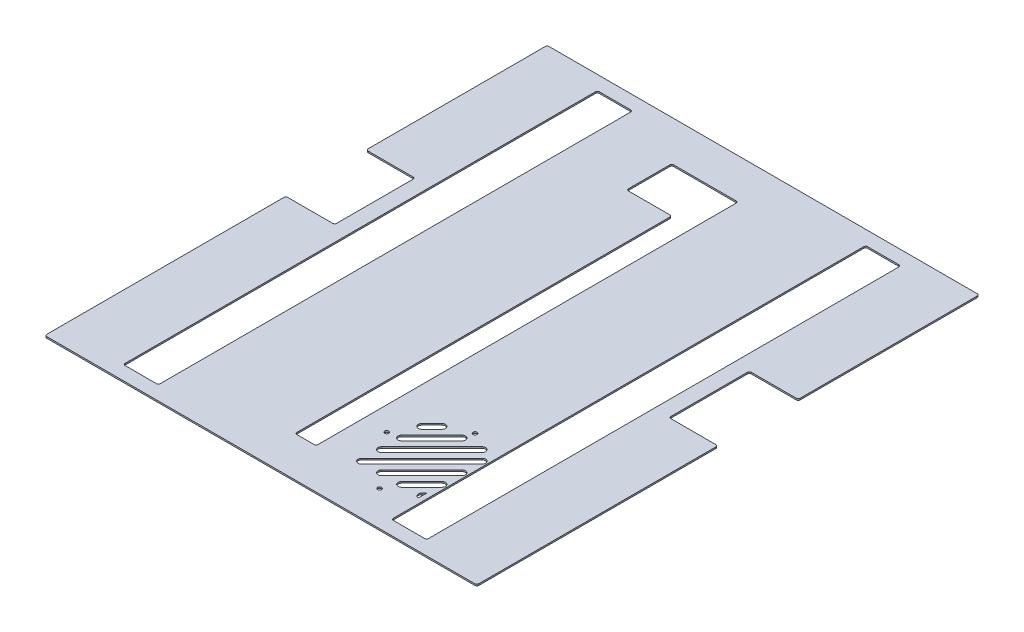
from build123d import *

# Parameters (mm, degrees)
SKETCH1_W           = 430
SKETCH1_H           = 500
BOSS_EXTRUDE1_DEPTH = 1.5
SKETCH2_W           = 48.6
SKETCH2_H           = 80
CUT_EXTRUDE1_DEPTH  = 10
SKETCH3_W           = 35
SKETCH3_H           = 472
CUT_EXTRUDE2_DEPTH  = 10
CUT_EXTRUDE3_DEPTH  = 10
FILLET2_R           = 2
FILLET3_R           = 2
SKETCH6_R           = 2
CUT_EXTRUDE4_DEPTH  = 10


with BuildPart() as part:
    # Sketch1 → Boss-Extrude1 (new body)
    with BuildSketch(Plane(origin=(0, 0, 0), x_dir=(1, 0, 0), z_dir=(0, 1, 0))):
        with Locations((6126.084066999, -8702.312377786)):
            Rectangle(SKETCH1_W, SKETCH1_H)
    extrude(amount=BOSS_EXTRUDE1_DEPTH)

    # Sketch2 → Cut-Extrude1 (cut)
    with BuildSketch(Plane(origin=(0, 1.5, 0), x_dir=(1, 0, 0), z_dir=(0, 1, 0))):
        with Locations((5935.384066999, -8672.447976714)):
            Rectangle(SKETCH2_W, SKETCH2_H)
        with Locations((6316.784066999, -8672.447976714)):
            Rectangle(SKETCH2_W, SKETCH2_H)
    extrude(amount=-CUT_EXTRUDE1_DEPTH, mode=Mode.SUBTRACT)

    # Sketch3 → Cut-Extrude2 (cut)
    with BuildSketch(Plane(origin=(0, 1.5, 0), x_dir=(1, 0, 0), z_dir=(0, 1, 0))):
        Polygon((5975.084066999, -8541.651929061), (5975.084066999, -8938.312377786), (6010.084066999, -8938.312377786), (6010.084066999, -8466.312377786), (5975.084066999, -8466.312377786), align=None)
        with Locations((6259.584066999, -8702.312377786)):
            Rectangle(SKETCH3_W, SKETCH3_H)
        Polygon((6111.084066999, -8492.312377786), (6141.084066999, -8492.312377786), (6141.084066999, -8912.312377786), (6120.084066999, -8912.312377786), (6120.084066999, -8537.312377786), (6075.084066999, -8537.312377786), (6075.084066999, -8492.312377786), align=None)
    extrude(amount=-CUT_EXTRUDE2_DEPTH, mode=Mode.SUBTRACT)

    # Sketch4 → Cut-Extrude3 (cut)
    with BuildSketch(Plane(origin=(0, 1.5, 0), x_dir=(1, 0, 0), z_dir=(0, 1, 0))):
        with BuildLine():
            Line((6234.584067167, -8840.596520357), (6177.084066999, -8898.096518708))
            Line((6177.084066999, -8898.096518708), (6174.584066999, -8900.596520952))
            ThreePointArc((6174.584066999, -8900.596520952), (6174.584069169, -8905.596518633), (6179.584066849, -8905.596518637))
            Line((6179.584066849, -8905.596518637), (6237.084067092, -8848.096520211))
            Line((6237.084067092, -8848.096520211), (6239.584067017, -8845.596520365))
            ThreePointArc((6239.584067017, -8845.596520365), (6239.584067096, -8840.596520436), (6234.584067167, -8840.596520357))
        make_face()
        with BuildLine():
            ThreePointArc((6174.584067387, -8880.596519017), (6174.584067598, -8885.596518612), (6179.584067193, -8885.596518981))
            Line((6179.584067193, -8885.596518981), (6229.584067988, -8835.596519766))
            ThreePointArc((6229.584067988, -8835.596519766), (6229.584069287, -8830.596518949), (6224.584068469, -8830.596519802))
            Line((6224.584068469, -8830.596519802), (6222.084069197, -8833.096518708))
            Line((6222.084069197, -8833.096518708), (6174.584067387, -8880.596519017))
        make_face()
        with BuildLine():
            ThreePointArc((6174.584067774, -8860.596519406), (6174.584068373, -8865.596518613), (6179.58406758, -8865.59651937))
            Line((6179.58406758, -8865.59651937), (6209.58406806, -8835.596519838))
            ThreePointArc((6209.58406806, -8835.596519838), (6209.584069287, -8830.596518805), (6204.584068254, -8830.596519874))
            Line((6204.584068254, -8830.596519874), (6174.584067774, -8860.596519406))
        make_face()
        with BuildLine():
            Line((6219.584066911, -8905.596518637), (6239.584067017, -8885.596519163))
            ThreePointArc((6239.584067017, -8885.596519163), (6239.584067096, -8880.596519234), (6234.584067167, -8880.596519155))
            Line((6234.584067167, -8880.596519155), (6214.584067061, -8900.596518629))
            ThreePointArc((6214.584067061, -8900.596518629), (6214.584066907, -8905.596518633), (6219.584066911, -8905.596518637))
        make_face()
        with BuildLine():
            ThreePointArc((6174.584068161, -8840.596519794), (6174.584069147, -8845.596518614), (6179.584067967, -8845.596519758))
            Line((6179.584067967, -8845.596519758), (6189.584068132, -8835.59651991))
            ThreePointArc((6189.584068132, -8835.59651991), (6189.584069431, -8830.596518805), (6184.584068325, -8830.596519946))
            Line((6184.584068325, -8830.596519946), (6174.584068161, -8840.596519794))
        make_face()
        with BuildLine():
            Line((6234.584067693, -8860.59651923), (6194.58406703, -8900.596518629))
            ThreePointArc((6194.58406703, -8900.596518629), (6194.584066876, -8905.596518633), (6199.58406688, -8905.596518637))
            Line((6199.58406688, -8905.596518637), (6237.084067092, -8868.096519609))
            Line((6237.084067092, -8868.096519609), (6239.584067543, -8865.596517133))
            ThreePointArc((6239.584067543, -8865.596517133), (6239.584066044, -8860.596518783), (6234.584067693, -8860.59651923))
        make_face()
        with BuildLine():
            Line((6237.084067092, -8898.096518708), (6234.584067092, -8900.596518629))
            ThreePointArc((6234.584067092, -8900.596518629), (6233.817659407, -8904.449508447), (6237.084067092, -8906.632051027))
            Line((6237.084067092, -8906.632051027), (6237.084067092, -8898.096518708))
        make_face()
    extrude(amount=-CUT_EXTRUDE3_DEPTH, mode=Mode.SUBTRACT)

    # Fillet2
    fillet2_edges = [part.edges().sort_by_distance(p)[0] for p in [
        (6292.484066999, 0.75, 8632.447976714),
        (6341.084066999, 0.75, 8632.447976714),
        (6341.084066999, 0.75, 8712.447976714),
        (6292.484066999, 0.75, 8712.447976714),
        (5959.684066999, 0.75, 8632.447976714),
        (5959.684066999, 0.75, 8712.447976714),
        (5911.084066999, 0.75, 8712.447976714),
        (5911.084066999, 0.75, 8632.447976714),
        (5911.084066999, 0.75, 8452.312377786),
        (6341.084066999, 0.75, 8452.312377786),
        (6341.084066999, 0.75, 8952.312377786),
        (5911.084066999, 0.75, 8952.312377786),
    ]]
    fillet(fillet2_edges, radius=FILLET2_R)

    # Fillet3
    fillet3_edges = [part.edges().sort_by_distance(p)[0] for p in [
        (6010.084066999, 0.75, 8938.312377786),
        (5975.084066999, 0.75, 8938.312377786),
        (6010.084066999, 0.75, 8466.312377786),
        (5975.084066999, 0.75, 8466.312377786),
        (6277.084066999, 0.75, 8938.312377786),
        (6242.084066999, 0.75, 8938.312377786),
        (6277.084066999, 0.75, 8466.312377786),
        (6242.084066999, 0.75, 8466.312377786),
        (6141.084066999, 0.75, 8912.312377786),
        (6120.084066999, 0.75, 8912.312377786),
        (6141.084066999, 0.75, 8492.312377786),
        (6120.084066999, 0.75, 8537.312377786),
        (6075.084066999, 0.75, 8492.312377786),
        (6075.084066999, 0.75, 8537.312377786),
    ]]
    fillet(fillet3_edges, radius=FILLET3_R)

    # Sketch6 → Cut-Extrude4 (cut)
    with BuildSketch(Plane(origin=(0, 1.5, 0), x_dir=(1, 0, 0), z_dir=(0, 1, 0))):
        with Locations((6209.584066999, -8822.590833699)):
            Circle(SKETCH6_R)
        with Locations((6209.584066999, -8917.590833699)):
            Circle(SKETCH6_R)
        with Locations((6164.584066999, -8865.596518708)):
            Circle(SKETCH6_R)
    extrude(amount=-CUT_EXTRUDE4_DEPTH, mode=Mode.SUBTRACT)


solid = part.part
